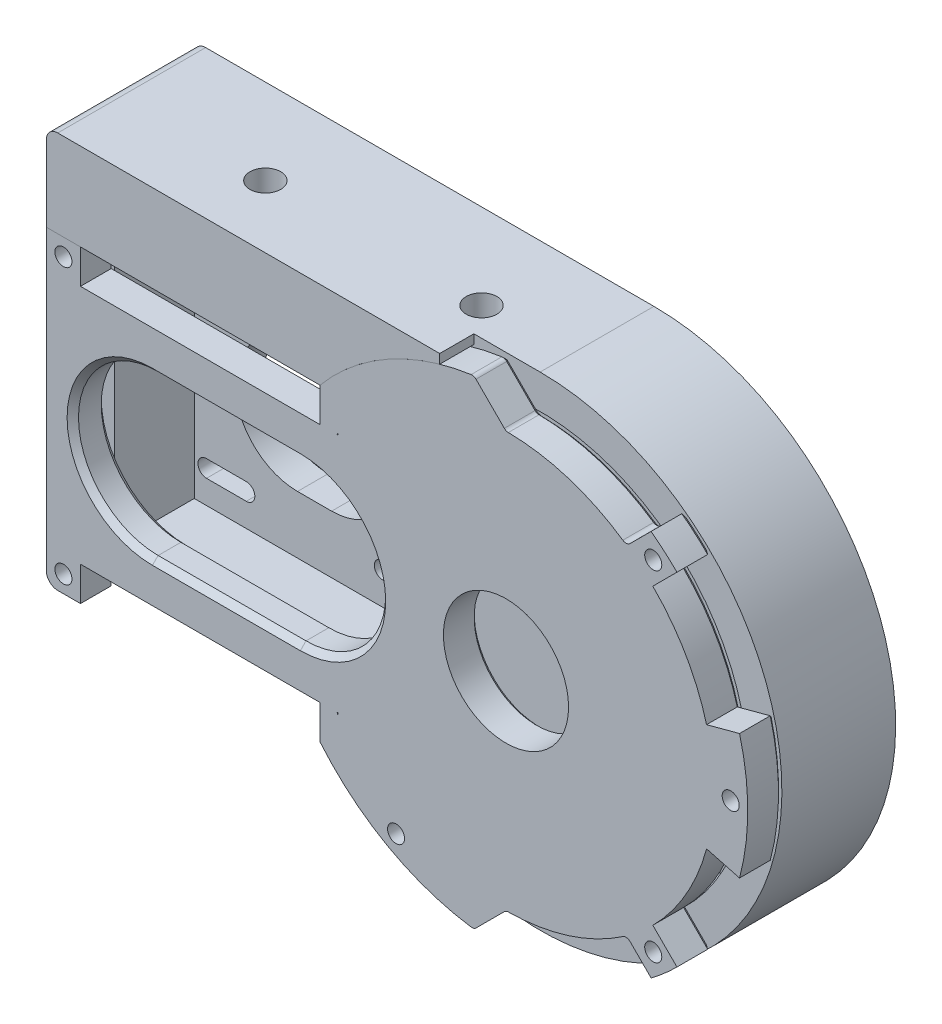
from build123d import *

# Parameters (mm, degrees)
SKETCH1_W             = 42.3
SKETCH1_H             = 42.3
SKETCH1_R             = 11
SKETCH1_R_2           = 1.5
SKETCH1_W_2           = 50
BOSS_EXTRUDE1_DEPTH   = 6
SKETCH3_R             = 11
BOSS_EXTRUDE2_DEPTH   = 6
BOSS_EXTRUDE3_DEPTH   = 20
BOSS_EXTRUDE4_DEPTH   = 20
CUT_EXTRUDE1_DEPTH    = 107.052215913
BOSS_EXTRUDE6_DEPTH   = 6
CHAMFER2_SIZE         = 0.6
CHAMFER3_SIZE         = 6
FILLET5_R             = 1
CHAMFER4_SIZE         = 0.6
CUT_EXTRUDE7_DEPTH    = 6
CHAMFER5_SIZE         = 1
BOSS_EXTRUDE14_START  = -26
BOSS_EXTRUDE14_DEPTH  = 26
CUT_EXTRUDE8_DEPTH    = 6
CUT_EXTRUDE9_DEPTH    = 15.5
SKETCH20_R            = 2.7
CUT_EXTRUDE10_DEPTH   = 119.203828195
FILLET8_R             = 2
FILLET9_R             = 2
CROQUIS1_R            = 1.5
CORTAR_EXTRUIR1_DEPTH = 10


with BuildPart() as part:
    # Sketch1 → Boss-Extrude1 (new body)
    # profile 1 of 2: a face of its own
    with BuildSketch(Plane.XY):
        Rectangle(SKETCH1_W, SKETCH1_H)
        Circle(SKETCH1_R, mode=Mode.SUBTRACT)
        with Locations((-15.5, -15.5)):
            Circle(SKETCH1_R_2, mode=Mode.SUBTRACT)
        with Locations((15.5, -15.5)):
            Circle(SKETCH1_R_2, mode=Mode.SUBTRACT)
        with Locations((15.5, 15.5)):
            Circle(SKETCH1_R_2, mode=Mode.SUBTRACT)
        with Locations((-15.5, 15.5)):
            Circle(SKETCH1_R_2, mode=Mode.SUBTRACT)
    # profile 2 of 2: a face of its own
    with BuildSketch(Plane.XY):
        with Locations((46.15, 0)):
            Rectangle(SKETCH1_W_2, SKETCH1_H)
        with Locations((53.65, 0)):
            Circle(SKETCH1_R, mode=Mode.SUBTRACT)
    extrude(amount=BOSS_EXTRUDE1_DEPTH)

    # Sketch3 → Boss-Extrude2 (add)
    with BuildSketch(Plane.XY):
        with BuildLine():
            ThreePointArc((90.15, 0), (64.75085173, 34.770980585), (23.902268994, 21.15))
            ThreePointArc((23.902268994, 21.15), (17.15, 0), (23.902268994, -21.15))
            ThreePointArc((23.902268994, -21.15), (64.75085173, -34.770980585), (90.15, 0))
        make_face()
        with Locations((53.65, 0)):
            Circle(SKETCH3_R, mode=Mode.SUBTRACT)
    extrude(amount=BOSS_EXTRUDE2_DEPTH)

    # Sketch3<3> → Boss-Extrude3 (add)
    with BuildSketch(Plane.XY):
        with BuildLine():
            ThreePointArc((96.15, 0), (64.594075149, 41.066741034), (16.786366159, 21.15))
            Line((16.786366159, 21.15), (23.902268994, 21.15))
            ThreePointArc((23.902268994, 21.15), (64.75085173, 34.770980585), (90.15, 0))
            ThreePointArc((90.15, 0), (64.75085173, -34.770980585), (23.902268994, -21.15))
            Line((23.902268994, -21.15), (16.786366159, -21.15))
            ThreePointArc((16.786366159, -21.15), (64.594075149, -41.066741034), (96.15, 0))
        make_face()
    extrude(amount=BOSS_EXTRUDE3_DEPTH)

    # Sketch1<3> → Boss-Extrude4 (add)
    with BuildSketch(Plane.XY):
        Polygon((24.15, 27.15), (21.15, 27.15), (-27.15, 27.15), (-27.15, -27.15), (21.15, -27.15), (24.15, -27.15), (24.15, -21.15), (21.15, -21.15), (-21.15, -21.15), (-21.15, 21.15), (21.15, 21.15), (24.15, 21.15), align=None)
    extrude(amount=BOSS_EXTRUDE4_DEPTH)

    # Sketch4 → Cut-Extrude1 (cut, through all)
    with BuildSketch(Plane.XY.offset(6)):
        with BuildLine():
            Line((-19, 17), (-12, 17))
            ThreePointArc((-12, 17), (-10.5, 15.5), (-12, 14))
            Line((-12, 14), (-19, 14))
            ThreePointArc((-19, 14), (-20.5, 15.5), (-19, 17))
        make_face()
        with BuildLine():
            Line((12, 17), (19, 17))
            ThreePointArc((19, 17), (20.5, 15.5), (19, 14))
            Line((19, 14), (12, 14))
            ThreePointArc((12, 14), (10.5, 15.5), (12, 17))
        make_face()
        with BuildLine():
            Line((12, -14), (19, -14))
            ThreePointArc((19, -14), (20.5, -15.5), (19, -17))
            Line((19, -17), (12, -17))
            ThreePointArc((12, -17), (10.5, -15.5), (12, -14))
        make_face()
        with BuildLine():
            Line((-12, -17), (-19, -17))
            ThreePointArc((-19, -17), (-20.5, -15.5), (-19, -14))
            Line((-19, -14), (-12, -14))
            ThreePointArc((-12, -14), (-10.5, -15.5), (-12, -17))
        make_face()
        with BuildLine():
            Line((-3, 11), (3, 11))
            ThreePointArc((3, 11), (14, 0), (3, -11))
            Line((3, -11), (-3, -11))
            ThreePointArc((-3, -11), (-14, 0), (-3, 11))
        make_face()
    extrude(amount=-CUT_EXTRUDE1_DEPTH, mode=Mode.SUBTRACT)

    # Chamfer2
    chamfer2_edges = [part.edges().sort_by_distance(p)[0] for p in [
        (-15.5, 14, 0),
        (-15.5, 17, 0),
        (0, -11, 0),
        (42.65, 0, 0),
        (0, 11, 0),
        (-15.5, -14, 0),
        (-15.5, -17, 0),
        (15.5, -17, 0),
        (15.5, -14, 0),
        (15.5, 14, 0),
        (15.5, 17, 0),
        (10.5, 15.5, 0),
        (20.5, 15.5, 0),
        (10.5, -15.5, 0),
        (20.5, -15.5, 0),
        (-10.5, -15.5, 0),
        (-20.5, -15.5, 0),
        (-14, 0, 0),
        (14, 0, 0),
        (-20.5, 15.5, 0),
        (-10.5, 15.5, 0),
    ]]
    chamfer(chamfer2_edges, length=CHAMFER2_SIZE)

    # Sketch17 → Boss-Extrude14 (add)
    with BuildSketch(Plane(origin=(0, 0, 0), x_dir=(-1, 0, 0), z_dir=(0, 0, -1)).offset(BOSS_EXTRUDE14_START)):
        with BuildLine():
            Line((27.15, 27.15), (-20.952484804, 27.15))
            ThreePointArc((-20.952484804, 27.15), (-35.589338329, 38.47158042), (-53.65, 42.5))
            Line((-53.65, 42.5), (27.15, 42.5))
            Line((27.15, 42.5), (27.15, 27.15))
        make_face()
    extrude(amount=BOSS_EXTRUDE14_DEPTH)

    # Sketch18 → Cut-Extrude8 (cut)
    with BuildSketch(Plane.XY.offset(26)):
        with BuildLine():
            Line((42, 42.5), (42, 40.872087052))
            ThreePointArc((42, 40.872087052), (47.768405816, 42.091054274), (53.65, 42.5))
            Line((53.65, 42.5), (42, 42.5))
        make_face()
    extrude(amount=-CUT_EXTRUDE8_DEPTH, mode=Mode.SUBTRACT)

    # Sketch19 → Cut-Extrude9 (cut)
    with BuildSketch(Plane.XZ.offset(-21.15)):
        Polygon((3.121281292, 19.8), (-2.421281292, 19.8), (-5.192562584, 15), (-2.421281292, 10.2), (3.121281292, 10.2), (5.892562584, 15), align=None)
        Polygon((41.121281292, 19.8), (35.578718708, 19.8), (32.807437416, 15), (35.578718708, 10.2), (41.121281292, 10.2), (43.892562584, 15), align=None)
    extrude(amount=-CUT_EXTRUDE9_DEPTH, mode=Mode.SUBTRACT)

    # Sketch20 → Cut-Extrude10 (cut, through all)
    with BuildSketch(Plane.XZ.offset(-21.15)):
        with Locations(Location((0.35, 15, 0), (0, 0, 270))):
            Circle(SKETCH20_R)
        with Locations(Location((38.35, 15, 0), (0, 0, 270))):
            Circle(SKETCH20_R)
    extrude(amount=-CUT_EXTRUDE10_DEPTH, mode=Mode.SUBTRACT)

    # Fillet8
    fillet8_edges = [part.edges().sort_by_distance(p)[0] for p in [
        (-27.15, 42.5, 13),
        (20.952484804, -27.15, 10),
        (-27.15, -27.15, 10),
    ]]
    fillet(fillet8_edges, radius=FILLET8_R)


with BuildPart() as body_2:
    # Sketch5 → Boss-Extrude6 (new body)
    with BuildSketch(Plane.XY.offset(20)):
        Polygon((-27.15, 27.15), (-27.15, -27.15), (-21.15, -27.15), (-21.15, -21.15), (-21.15, 21.15), (-21.15, 27.15), align=None)
        with BuildLine():
            Line((-21.15, 21.15), (-21.15, -21.15))
            Line((-21.15, -21.15), (20.952484804, -21.15))
            Line((20.952484804, -21.15), (23.902268994, -21.15))
            Line((23.902268994, -21.15), (24.15, -21.15))
            Line((24.15, -21.15), (24.15, -21.49418526))
            ThreePointArc((24.15, -21.49418526), (37.101401298, -32.532966065), (53.65, -36.5))
            Line((53.65, -36.5), (53.65, -11))
            ThreePointArc((53.65, -11), (42.65, 0), (53.65, 11))
            Line((53.65, 11), (53.65, 36.5))
            ThreePointArc((53.65, 36.5), (37.101401298, 32.532966065), (24.15, 21.49418526))
            Line((24.15, 21.49418526), (24.15, 21.15))
            Line((24.15, 21.15), (23.902268994, 21.15))
            Line((23.902268994, 21.15), (20.952484804, 21.15))
            Line((20.952484804, 21.15), (-21.15, 21.15))
        make_face()
        with BuildLine():
            ThreePointArc((53.65, 42.5), (35.589338329, 38.47158042), (20.952484804, 27.15))
            Line((20.952484804, 27.15), (20.952484804, 21.15))
            Line((20.952484804, 21.15), (23.902268994, 21.15))
            ThreePointArc((23.902268994, 21.15), (24.025634636, 21.32245241), (24.15, 21.49418526))
            ThreePointArc((24.15, 21.49418526), (37.101401298, 32.532966065), (53.65, 36.5))
            Line((53.65, 36.5), (53.65, 42.5))
        make_face()
        with BuildLine():
            Line((20.952484804, -21.15), (20.952484804, -27.15))
            ThreePointArc((20.952484804, -27.15), (35.589338329, -38.47158042), (53.65, -42.5))
            Line((53.65, -42.5), (53.65, -36.5))
            ThreePointArc((53.65, -36.5), (37.101401298, -32.532966065), (24.15, -21.49418526))
            ThreePointArc((24.15, -21.49418526), (24.025634636, -21.32245241), (23.902268994, -21.15))
            Line((23.902268994, -21.15), (20.952484804, -21.15))
        make_face()
        with BuildLine():
            Line((61.428174593, -7.778174593), (79.459397513, -25.809397513))
            ThreePointArc((79.459397513, -25.809397513), (85.259927238, -18.25), (88.90629266, -9.446895146))
            Line((88.90629266, -9.446895146), (64.275184089, -2.847009496))
            ThreePointArc((64.275184089, -2.847009496), (63.176279442, -5.5), (61.428174593, -7.778174593))
        make_face()
        with BuildLine():
            Line((55.926561718, -10.761843092), (74.865658549, -29.700939923))
            ThreePointArc((74.865658549, -29.700939923), (77.242901475, -27.850044883), (79.459397513, -25.809397513))
            Line((79.459397513, -25.809397513), (61.428174593, -7.778174593))
            ThreePointArc((61.428174593, -7.778174593), (58.894044241, -9.669539803), (55.926561718, -10.761843092))
        make_face()
        with BuildLine():
            Line((53.65, -11), (53.65, -36.5))
            ThreePointArc((53.65, -36.5), (64.789248018, -34.758698963), (74.865658549, -29.700939923))
            Line((74.865658549, -29.700939923), (55.926561718, -10.761843092))
            ThreePointArc((55.926561718, -10.761843092), (54.794492461, -10.940298762), (53.65, -11))
        make_face()
        with BuildLine():
            ThreePointArc((88.90629266, 9.446895146), (85.259927238, 18.25), (79.459397513, 25.809397513))
            Line((79.459397513, 25.809397513), (61.428174593, 7.778174593))
            ThreePointArc((61.428174593, 7.778174593), (63.176279442, 5.5), (64.275184089, 2.847009496))
            Line((64.275184089, 2.847009496), (88.90629266, 9.446895146))
        make_face()
        with BuildLine():
            ThreePointArc((79.459397513, 25.809397513), (77.242901475, 27.850044883), (74.865658549, 29.700939923))
            Line((74.865658549, 29.700939923), (55.926561718, 10.761843092))
            ThreePointArc((55.926561718, 10.761843092), (58.894044241, 9.669539803), (61.428174593, 7.778174593))
            Line((61.428174593, 7.778174593), (79.459397513, 25.809397513))
        make_face()
        with BuildLine():
            ThreePointArc((74.865658549, 29.700939923), (64.789248018, 34.758698963), (53.65, 36.5))
            Line((53.65, 36.5), (53.65, 11))
            ThreePointArc((53.65, 11), (54.794492461, 10.940298762), (55.926561718, 10.761843092))
            Line((55.926561718, 10.761843092), (74.865658549, 29.700939923))
        make_face()
        with BuildLine():
            Line((64.275184089, -2.847009496), (88.90629266, -9.446895146))
            ThreePointArc((88.90629266, -9.446895146), (89.83773744, -4.764206016), (90.15, 0))
            Line((90.15, 0), (64.65, 0))
            ThreePointArc((64.65, 0), (64.555893475, -1.435788114), (64.275184089, -2.847009496))
        make_face()
        with BuildLine():
            ThreePointArc((64.275184089, 2.847009496), (64.555893475, 1.435788114), (64.65, 0))
            Line((64.65, 0), (90.15, 0))
            ThreePointArc((90.15, 0), (89.83773744, 4.764206016), (88.90629266, 9.446895146))
            Line((88.90629266, 9.446895146), (64.275184089, 2.847009496))
        make_face()
        with BuildLine():
            ThreePointArc((83.7020382, 30.0520382), (81.500044883, 32.103348735), (79.158409715, 33.993691089))
            Line((79.158409715, 33.993691089), (74.865658549, 29.700939923))
            ThreePointArc((74.865658549, 29.700939923), (77.242901475, 27.850044883), (79.459397513, 25.809397513))
            Line((79.459397513, 25.809397513), (83.7020382, 30.0520382))
        make_face()
        with BuildLine():
            Line((74.865658549, -29.700939923), (79.158409715, -33.993691089))
            ThreePointArc((79.158409715, -33.993691089), (81.500044883, -32.103348735), (83.7020382, -30.0520382))
            Line((83.7020382, -30.0520382), (79.459397513, -25.809397513))
            ThreePointArc((79.459397513, -25.809397513), (77.242901475, -27.850044883), (74.865658549, -29.700939923))
        make_face()
        with BuildLine():
            Line((88.90629266, -9.446895146), (94.701847617, -10.999809417))
            ThreePointArc((94.701847617, -10.999809417), (95.786406608, -5.547363169), (96.15, 0))
            Line((96.15, 0), (90.15, 0))
            ThreePointArc((90.15, 0), (89.83773744, -4.764206016), (88.90629266, -9.446895146))
        make_face()
        with BuildLine():
            Line((90.15, 0), (96.15, 0))
            ThreePointArc((96.15, 0), (95.786406608, 5.547363169), (94.701847617, 10.999809417))
            Line((94.701847617, 10.999809417), (88.90629266, 9.446895146))
            ThreePointArc((88.90629266, 9.446895146), (89.83773744, 4.764206016), (90.15, 0))
        make_face()
    extrude(amount=BOSS_EXTRUDE6_DEPTH)

    # Chamfer3
    # the kernel refuses this chamfer: 6 mm, written as the material it takes off along each edge
    with BuildSketch(Plane(origin=(53.65, -57.930097928, 26), x_dir=(-1, 0, 0), z_dir=(0, 1, 0))) as chamfer3_piece_1_section:
        Polygon((CHAMFER3_SIZE, 0), (0, -CHAMFER3_SIZE), (0, 0), align=None)
    chamfer3_piece_1 = extrude(amount=36.860195856, mode=Mode.PRIVATE)
    chamfer3_piece_1 = split(chamfer3_piece_1, bisect_by=Plane(origin=(42.934951036, -47.215048964, 26), z_dir=(0.7071067811865471, -0.707106781186548, 0)), keep=Keep.TOP, mode=Mode.PRIVATE)
    add(chamfer3_piece_1, mode=Mode.SUBTRACT)
    with BuildSketch(Plane(origin=(53.65, -21.069902072, 20), x_dir=(0, 0, 1), z_dir=(0, -1, 0))) as chamfer3_piece_2_section:
        Polygon((CHAMFER3_SIZE, 0), (0, CHAMFER3_SIZE), (0, 0), align=None)
    chamfer3_piece_2 = extrude(amount=36.860195856, mode=Mode.PRIVATE)
    chamfer3_piece_2 = split(chamfer3_piece_2, bisect_by=Plane(origin=(61.365048964, -28.784951036, 20), z_dir=(0.7071067811865471, -0.707106781186548, 0)), keep=Keep.TOP, mode=Mode.PRIVATE)
    add(chamfer3_piece_2, mode=Mode.SUBTRACT)
    with BuildSketch(Plane(origin=(53.65, 21.069902072, 26), x_dir=(-1, 0, 0), z_dir=(0, 1, 0))) as chamfer3_piece_3_section:
        Polygon((CHAMFER3_SIZE, 0), (0, -CHAMFER3_SIZE), (0, 0), align=None)
    chamfer3_piece_3 = extrude(amount=36.860195856, mode=Mode.PRIVATE)
    chamfer3_piece_3 = split(chamfer3_piece_3, bisect_by=Plane(origin=(61.365048964, 28.784951036, 26), z_dir=(0.707106781186548, 0.7071067811865471, 0)), keep=Keep.TOP, mode=Mode.PRIVATE)
    add(chamfer3_piece_3, mode=Mode.SUBTRACT)
    with BuildSketch(Plane(origin=(53.65, 57.930097928, 20), x_dir=(0, 0, 1), z_dir=(0, -1, 0))) as chamfer3_piece_4_section:
        Polygon((CHAMFER3_SIZE, 0), (0, CHAMFER3_SIZE), (0, 0), align=None)
    chamfer3_piece_4 = extrude(amount=36.860195856, mode=Mode.PRIVATE)
    chamfer3_piece_4 = split(chamfer3_piece_4, bisect_by=Plane(origin=(42.934951036, 47.215048964, 20), z_dir=(0.707106781186548, 0.7071067811865471, 0)), keep=Keep.TOP, mode=Mode.PRIVATE)
    add(chamfer3_piece_4, mode=Mode.SUBTRACT)
    with BuildSketch(Plane(origin=(53.65, -42.5, 4.569902072), x_dir=(0, 1, 0), z_dir=(0, 0, 1))) as chamfer3_piece_5:
        with BuildLine():
            Line((CHAMFER3_SIZE, 0), (0.374018345, 5.625981655))
            ThreePointArc((0.374018345, 5.625981655), (0.098924284, 2.89806455), (0, 0))
            Line((0, 0), (CHAMFER3_SIZE, 0))
        make_face()
    extrude(amount=36.860195856, mode=Mode.SUBTRACT)
    with BuildSketch(Plane(origin=(53.65, 42.5, 4.569902072), x_dir=(-0.9977974665125984, -0.0663341225994588, 0), z_dir=(0, 0, 1))) as chamfer3_piece_6:
        with BuildLine():
            Line((5.638400421, 0), (CHAMFER3_SIZE * 0.0663341225995, CHAMFER3_SIZE * 0.997797466513))
            Line((CHAMFER3_SIZE * 0.0663341225995, CHAMFER3_SIZE * 0.997797466513), (0, 0))
            ThreePointArc((0, 0), (2.898243521, -0.093534169), (5.638400421, 0))
        make_face()
    extrude(amount=36.860195856, mode=Mode.SUBTRACT)

    # Fillet5
    fillet5_edges = [body_2.edges().sort_by_distance(p)[0] for p in [
        (48.024018345, 42.125981655, 23),
        (48.024018345, -42.125981655, 23),
        (74.865658549, -29.700939923, 23),
        (53.65, -36.5, 23),
        (53.65, 36.5, 23),
        (74.865658549, 29.700939923, 23),
    ]]
    fillet(fillet5_edges, radius=FILLET5_R)

    # Chamfer4
    chamfer4_edges = [body_2.edges().sort_by_distance(p)[0] for p in [
        (64.588724976, 34.822324677, 20),
        (77.308100443, 32.143381817, 20),
        (32.857018202, 37.066182808, 20),
        (50.867781033, 39.282218967, 20),
        (77.308100443, -32.143381817, 20),
        (64.588724976, -34.822324677, 20),
        (50.867781033, -39.282218967, 20),
        (47.983969489, -42.015864736, 20),
        (47.983969489, 42.015864736, 20),
        (74.844430569, 30.004583197, 20),
        (53.678718344, 36.575946721, 20),
        (74.844430569, -30.004583197, 20),
        (53.678718344, -36.575946721, 20),
        (24.15, -21.32209263, 20),
        (24.026134497, -21.15, 20),
        (24.025634636, -21.32245241, 20),
        (24.026134497, 21.15, 20),
        (24.15, 21.32209263, 20),
        (24.025634636, 21.32245241, 20),
        (46.953624281, -8.726886743, 20),
        (91.804070138, -10.223352282, 20),
        (85.259927238, -18.25, 20),
        (81.580717857, -27.930717857, 20),
        (81.500044883, -32.103348735, 20),
        (32.857018202, -37.066182808, 20),
        (20.952484804, -24.15, 20),
        (-0.098757598, -21.15, 20),
        (-21.15, -24.15, 20),
        (-24.15, -27.15, 20),
        (-27.15, 0, 20),
        (-24.15, 27.15, 20),
        (-21.15, 24.15, 20),
        (-0.098757598, 21.15, 20),
        (20.952484804, 24.15, 20),
        (81.500044883, 32.103348735, 20),
        (81.580717857, 27.930717857, 20),
        (85.259927238, 18.25, 20),
        (91.804070138, 10.223352282, 20),
        (96.15, 0, 20),
    ]]
    chamfer(chamfer4_edges, length=CHAMFER4_SIZE)

    # Sketch15 → Cut-Extrude7 (cut)
    with BuildSketch(Plane.XY.offset(26)):
        with BuildLine():
            Line((-8.5, 14), (17.5, 14))
            ThreePointArc((17.5, 14), (31.5, 0), (17.5, -14))
            Line((17.5, -14), (-8.5, -14))
            ThreePointArc((-8.5, -14), (-22.5, 0), (-8.5, 14))
        make_face()
    extrude(amount=-CUT_EXTRUDE7_DEPTH, mode=Mode.SUBTRACT)

    # Chamfer5
    chamfer5_edges = [body_2.edges().sort_by_distance(p)[0] for p in [
        (-22.5, 0, 26),
        (4.5, -14, 26),
        (31.5, 0, 26),
        (4.5, 14, 26),
        (4.5, -14, 20),
        (-22.5, 0, 20),
        (4.5, 14, 20),
        (31.5, 0, 20),
    ]]
    chamfer(chamfer5_edges, length=CHAMFER5_SIZE)

    # Fillet9
    fillet9_edges = [body_2.edges().sort_by_distance(p)[0] for p in [
        (-27.15, -27.15, 23.3),
    ]]
    fillet(fillet9_edges, radius=FILLET9_R)


with BuildPart() as cortar_extruir1_tool:
    # Croquis1 → Cortar-Extruir1 (new body)
    with BuildSketch(Plane.XY.offset(26)):
        with Locations((-24.15, 24.15)):
            Circle(CROQUIS1_R)
        with Locations((-24.15, -24.15)):
            Circle(CROQUIS1_R)
        with Locations((93.15, 0)):
            Circle(CROQUIS1_R)
        with Locations((79.534159362, 29.837230001)):
            Circle(CROQUIS1_R)
        with Locations((79.534159362, -29.837230001)):
            Circle(CROQUIS1_R)
        with Locations((34.324758094, -34.449746375)):
            Circle(CROQUIS1_R)
    extrude(amount=-CORTAR_EXTRUIR1_DEPTH)


with BuildPart() as part_1:
    add(part.part)

    # Cortar-Extruir1: cut by cortar_extruir1_tool
    add(cortar_extruir1_tool.part, mode=Mode.SUBTRACT)


with BuildPart() as body_2_1:
    add(body_2.part)

    # Cortar-Extruir1: cut by cortar_extruir1_tool
    add(cortar_extruir1_tool.part, mode=Mode.SUBTRACT)


solid = Compound([part_1.part, body_2_1.part])
